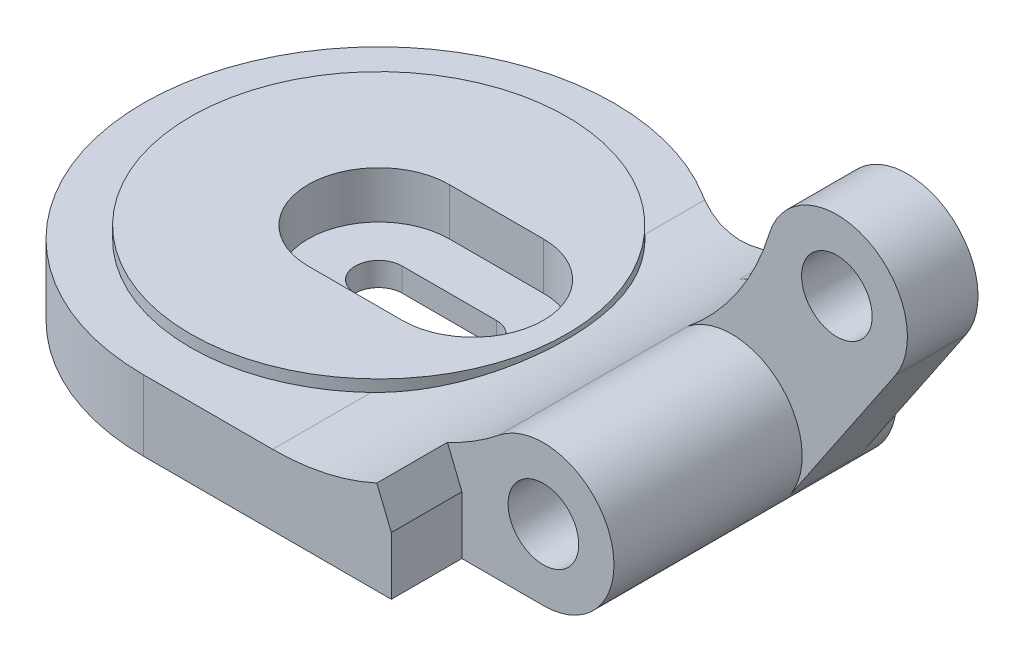
from build123d import *

# Parameters (mm, degrees)
SKETCH1_R           = 10
BOSS_EXTRUDE1_DEPTH = 3
BOSS_EXTRUDE2_DEPTH = 10
CUT_EXTRUDE1_DEPTH  = 8
BOSS_EXTRUDE6_START = -4
BOSS_EXTRUDE6_DEPTH = 3
FILLET1_R           = 10
SKETCH4_R           = 2.999999999999999
CUT_EXTRUDE2_DEPTH  = 2
SKETCH5_R           = 8
CUT_EXTRUDE3_DEPTH  = 2.5
SKETCH6_R           = 6
CUT_EXTRUDE4_DEPTH  = 2.5
CUT_EXTRUDE5_DEPTH  = 3
HOLE1_START         = -5
HOLE1_OUTLINE_R     = 1.5
HOLE1_DEPTH         = 12
SKETCH14_R          = 8
BOSS_EXTRUDE5_DEPTH = 3
CUT_EXTRUDE6_DEPTH  = 2
CUT_EXTRUDE7_DEPTH  = 2
FILLET5_R           = 0.5


# Read off the part's stored shape, not the designer's step: Boss-Extrude6, Hole1
with BuildPart() as part:
    # Sketch1 → Boss-Extrude1 (new body)
    with BuildSketch(Plane(origin=(0, 0, 0), x_dir=(1, 0, 0), z_dir=(0, 1, 0))):
        with Locations(Location((0, 0, 0), (0, 0, 270))):
            Circle(SKETCH1_R)
    extrude(amount=BOSS_EXTRUDE1_DEPTH)

    # Sketch2 → Boss-Extrude2 (add, symmetric)
    with BuildSketch(Plane.XY):
        with BuildLine():
            ThreePointArc((12.118241851863406, 5.336447361256301), (9.005233792596329, 3.6012213229490353), (5.492348724463198, 2.9999999999999964))
            Line((5.492348724463198, 2.999999999999999), (5.4923487244631986, 0))
            Line((5.4923487244631986, 0), (14, 0))
            ThreePointArc((14, 8.9e-16), (11.170747264402763, 2.002338254659653), (12.118241851863406, 5.336447361256301))
        make_face()
        with BuildLine():
            ThreePointArc((17, 3), (15.295130409570831, 5.706037180491961), (12.118241851863406, 5.336447361256301))
            ThreePointArc((12.118241851863406, 5.336447361256301), (11.170747264402763, 2.002338254659653), (14, 8.9e-16))
            ThreePointArc((14, 8.9e-16), (15.408414688357675, 0.3511572214232217), (16.48711271766513, 1.3224212895877674))
            ThreePointArc((16.48711271766513, 1.3224212895877674), (16.868914267889107, 2.1228848858317937), (17, 2.999999999999999))
        make_face()
        Polygon((5.492348724463198, 2.999999999999999), (5.4923487244631986, -2e-17), (0, 0), (0, 3.000000000000001), align=None)
    extrude(amount=BOSS_EXTRUDE2_DEPTH, both=True)

    # Sketch3 → Cut-Extrude1 (cut, symmetric)
    with BuildSketch(Plane(origin=(0, 3, 0), x_dir=(1, 0, 0), z_dir=(0, 1, 0))):
        with BuildLine():
            ThreePointArc((5.49234872446292, 8.356680291173674), (6.353206012799225, 7.7224849212498805), (7.141428428542965, 6.999999999999883))
            Line((7.141428428543003, 7), (20.223415730337077, 7))
            Line((20.223415730337077, 7), (20.223415730337077, 10))
            Line((20.223415730337077, 10), (5.492348724463198, 10))
            Line((5.492348724463198, 10), (5.492348724463198, 8.356680291173774))
        make_face()
        with BuildLine():
            Line((5.492348724463198, 10), (0, 10))
            ThreePointArc((6.1e-16, 10), (2.8664609790003457, 9.580365413483369), (5.49234872446292, 8.356680291173674))
            Line((5.492348724463198, 8.356680291173774), (5.492348724463198, 10))
        make_face()
    extrude(amount=CUT_EXTRUDE1_DEPTH, both=True, mode=Mode.SUBTRACT)

    # Boss-Extrude6 outline → Boss-Extrude6 (add)
    with BuildSketch(Plane.XY.offset(BOSS_EXTRUDE6_START)):
        with BuildLine():
            ThreePointArc((20.960655945, 7.95472187), (19.761477117, 12.341770325), (15.602307947, 10.501787764))
            ThreePointArc((15.602307947, 10.501787764), (14.249766943, 7.656401864), (12.118241854, 5.336447363))
            ThreePointArc((12.118241854, 5.336447363), (16.029708075, 5.209136739), (16.487112718, 1.32242129))
            Line((16.487112718, 1.32242129), (20.960655945, 7.95472187))
        make_face()
    extrude(amount=BOSS_EXTRUDE6_DEPTH)

    # Fillet1
    fillet1_edges = [part.edges().sort_by_distance(p)[0] for p in [
        (7.141428428542984, 1.5647577911253236, -6.999999999999941),
    ]]
    fillet(fillet1_edges, radius=FILLET1_R)

    # Sketch4 → Cut-Extrude2 (cut, symmetric)
    with BuildSketch(Plane.XY.offset(-7)):
        with Locations((14, 3)):
            Circle(SKETCH4_R)
    extrude(amount=CUT_EXTRUDE2_DEPTH, both=True, mode=Mode.SUBTRACT)

    # Sketch5 → Cut-Extrude3 (cut, symmetric)
    with BuildSketch(Plane(origin=(0, 3, 0), x_dir=(1, 0, 0), z_dir=(0, 1, 0))):
        with Locations(Location((0, 0, 0), (0, 0, 270))):
            Circle(SKETCH5_R)
    extrude(amount=CUT_EXTRUDE3_DEPTH, both=True, mode=Mode.SUBTRACT)

    # Sketch6 → Cut-Extrude4 (cut, symmetric)
    with BuildSketch(Plane(origin=(0, 0.49999999999999956, 0), x_dir=(1, 0, 0), z_dir=(0, 1, 0))):
        with Locations(Location((0, 0, 0), (0, 0, 270))):
            Circle(SKETCH6_R)
    extrude(amount=CUT_EXTRUDE4_DEPTH, both=True, mode=Mode.SUBTRACT)

    # Sketch7 → Cut-Extrude5 (cut)
    with BuildSketch(Plane(origin=(0, 0, 10), x_dir=(-1, 0, 0), z_dir=(0, 0, -1))):
        with BuildLine():
            Line((-14, -8.9e-16), (-10.535653752852738, 0))
            Line((-10.535653752852738, 0), (-10.535653752852738, 2.4576290293685137))
            Line((-10.535653752852737, 2.4576290293685137), (-9.920734510417693, 3.9730542612258857))
            ThreePointArc((-9.92073451041755, 3.973054261225835), (-11.061368455067633, 4.58724848237155), (-12.118241851863406, 5.3364473612562975))
            ThreePointArc((-12.118241851863406, 5.336447361256301), (-16.829252735597237, 3.9976617453403454), (-14.000000000000002, -2.22e-15))
        make_face()
    extrude(amount=CUT_EXTRUDE5_DEPTH, mode=Mode.SUBTRACT)

    # Hole1 outline → Hole1 (cut)
    with BuildSketch(Plane.XY.offset(HOLE1_START)):
        with Locations((14, 3)):
            Circle(HOLE1_OUTLINE_R)
    extrude(amount=HOLE1_DEPTH, mode=Mode.SUBTRACT)

    # Sketch13 → Ø3.0 mm Dowel Holes1 (revolve, cut)
    with BuildSketch(Plane(origin=(18.473543227765962, 9.632300580440345, -4), x_dir=(0, 1, 0), z_dir=(1, 0, 0))):
        Polygon((0, 0), (-3.43e-15, 14), (1.4999999999999967, 14), (1.4999999999999876, -1.37e-15), align=None)
    revolve(axis=Axis((18.473543227765962, 9.632300580440345, -10.34999999999999), (0, 0, 1)), mode=Mode.SUBTRACT)

    # Fillet5
    # the kernel refuses this fillet: 0.5 mm, written as the material it takes off along each edge
    with BuildSketch(Plane(origin=(14, 0, -13.123724356958832), x_dir=(-1, 0, 0), z_dir=(0, 0, 1))) as fillet5_piece_1:
        with BuildLine():
            CenterArc((2.4494897427835323, -0.5), FILLET5_R, 90, 135.584691402803)
            ThreePointArc((2.0995626366716245, -0.8571428571428326), (1.1338934190278316, -0.22253970068240747), (0, 0))
            Line((0, 0), (2.4494897427835323, 0))
        make_face()
    extrude(amount=8.123724356958832, mode=Mode.SUBTRACT)
    with BuildSketch(Plane(origin=(12.118241851863406, 5.336447361256301, -12.280688138935865), x_dir=(-0.5249896042858109, -0.8511086390066945, 0), z_dir=(0, 0, 1))) as fillet5_piece_2:
        with BuildLine():
            CenterArc((2.168111981095238, -0.471365198670144), FILLET5_R, 109.4847340766443, 129.55434819465773)
            ThreePointArc((1.9108853465691438, -0.9001244067233106), (0.9779980770614156, -0.4021790549421846), (0, 0))
            ThreePointArc((0, 0), (1.0006670681978018, -0.17180880797913198), (2.0013341363956045, 7e-17))
        make_face()
    extrude(amount=7.280688138935865, mode=Mode.SUBTRACT)


with BuildPart() as body_2:
    # Sketch14 → Boss-Extrude5 (new body)
    with BuildSketch(Plane(origin=(0, 0.49999999999999956, 0), x_dir=(1, 0, 0), z_dir=(0, 1, 0))):
        with Locations(Location((0, 0, 0), (0, 0, 270))):
            Circle(SKETCH14_R)
    extrude(amount=BOSS_EXTRUDE5_DEPTH)

    # Sketch15 → Cut-Extrude6 (cut)
    with BuildSketch(Plane(origin=(0, 3.4999999999999996, 0), x_dir=(1, 0, 0), z_dir=(0, 1, 0))):
        with BuildLine():
            Line((0, 3.000000000000001), (4, 3))
            ThreePointArc((4, 3), (7, 0), (4, -3))
            Line((4, -3), (0, -3.000000000000001))
            ThreePointArc((0, -3.000000000000001), (-3.000000000000001, 3.7e-16), (0, 3.000000000000001))
        make_face()
    extrude(amount=-CUT_EXTRUDE6_DEPTH, mode=Mode.SUBTRACT)

    # Sketch17 → Cut-Extrude7 (cut)
    with BuildSketch(Plane(origin=(0, 1.4999999999999996, 0), x_dir=(1, 0, 0), z_dir=(0, 1, 0))):
        with BuildLine():
            Line((-4.3e-16, -1.0000000000000009), (4, -1))
            ThreePointArc((4, -1), (5, 0), (4, 1))
            Line((4, 1), (0, 1.0000000000000009))
            ThreePointArc((0, 1.0000000000000009), (-1.0000000000000009, 1.2e-16), (-4.3e-16, -1.0000000000000009))
        make_face()
    extrude(amount=-CUT_EXTRUDE7_DEPTH, mode=Mode.SUBTRACT)


solid = Compound([part.part, body_2.part])
